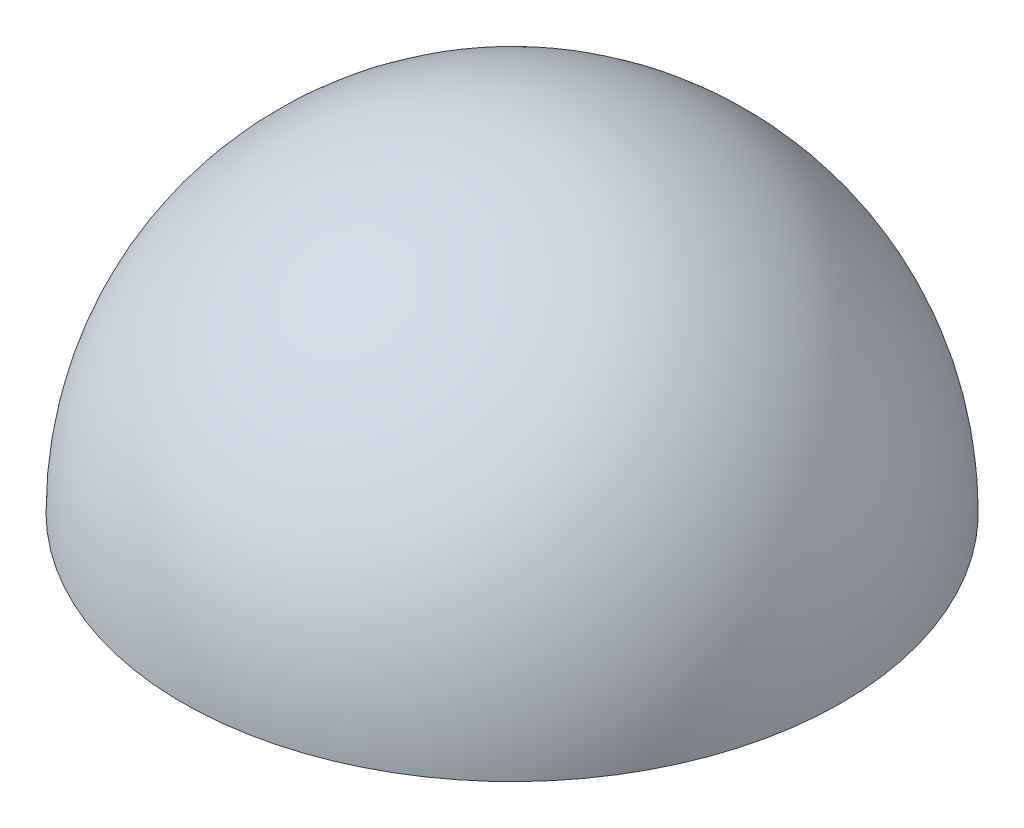
from build123d import *

# Parameters (mm, degrees)
REVOLVE1_ANGLE = 180


with BuildPart() as part:
    # Sketch1 → Revolve1 (revolve)
    with BuildSketch(Plane(origin=(0, 0, 0), x_dir=(1, 0, 0), z_dir=(0, 1, 0))):
        with BuildLine():
            Line((-8.66107644, -8.987637905), (-19.722651504, 26.843794624))
            ThreePointArc((-19.722651504, 26.843794624), (-32.107580236, 3.397290827), (-8.66107644, -8.987637905))
        make_face()
    revolve(axis=Axis((-19.722651504, 0, -26.843794624), (-0.294975335032854, 0, -0.9555048674508444)), revolution_arc=REVOLVE1_ANGLE)


solid = part.part
